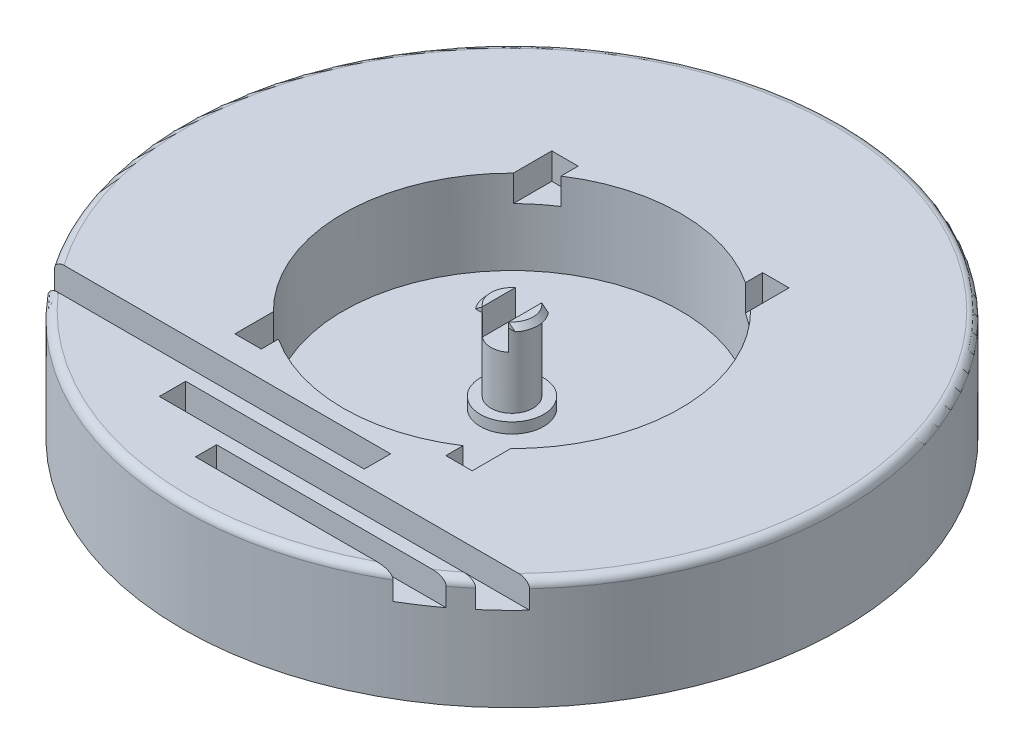
from build123d import *

# Parameters (mm, degrees)
SKETCH1_R           = 62.5
BOSS_EXTRUDE1_DEPTH = 21
SKETCH2_R           = 32
SKETCH2_R_2         = 6
CUT_EXTRUDE1_DEPTH  = 16
SKETCH3_R           = 6
SKETCH3_R_2         = 4
CUT_EXTRUDE2_DEPTH  = 14
CUT_EXTRUDE7_START  = -5
CUT_EXTRUDE7_DEPTH  = 5
FILLET1_R           = 1.5
BOSS_EXTRUDE2_START = 1
SKETCH12_R          = 4
BOSS_EXTRUDE2_DEPTH = 1
BOSS_EXTRUDE3_DEPTH = 1
SKETCH14_W          = 5
SKETCH14_H          = 8
CUT_EXTRUDE9_DEPTH  = 5


# Read off the part's stored shape, not the designer's step: Cut-Extrude7
with BuildPart() as part:
    # Sketch1 → Boss-Extrude1 (new body)
    with BuildSketch(Plane(origin=(0, 0, 0), x_dir=(1, 0, 0), z_dir=(0, 1, 0))):
        with Locations(Location((0, 0, 0), (0, 0, 90))):
            Circle(SKETCH1_R)
    extrude(amount=BOSS_EXTRUDE1_DEPTH)

    # Sketch2 → Cut-Extrude1 (cut)
    with BuildSketch(Plane(origin=(0, 21, 0), x_dir=(1, 0, 0), z_dir=(0, 1, 0))):
        with Locations(Location((0, 0, 0), (0, 0, 270))):
            Circle(SKETCH2_R)
        with Locations(Location((0, 0, 0), (0, 0, 270))):
            Circle(SKETCH2_R_2, mode=Mode.SUBTRACT)
    extrude(amount=-CUT_EXTRUDE1_DEPTH, mode=Mode.SUBTRACT)

    # Sketch3 → Cut-Extrude2 (cut)
    with BuildSketch(Plane(origin=(0, 21, 0), x_dir=(1, 0, 0), z_dir=(0, 1, 0))):
        with Locations(Location((0, 0, 0), (0, 0, 270))):
            Circle(SKETCH3_R)
        with Locations(Location((0, 0, 0), (0, 0, 270))):
            Circle(SKETCH3_R_2, mode=Mode.SUBTRACT)
    extrude(amount=-CUT_EXTRUDE2_DEPTH, mode=Mode.SUBTRACT)

    # Cut-Extrude7 outline → Cut-Extrude7 (cut)
    with BuildSketch(Plane(origin=(0, 21, 0), x_dir=(1, 0, 0), z_dir=(0, 1, 0)).offset(CUT_EXTRUDE7_START)):
        with BuildLine():
            Line((-48.023431781, -40), (11.976568219, -40))
            Line((11.976568219, -40), (11.976568219, -35))
            Line((11.976568219, -35), (-51.780787943, -35))
            ThreePointArc((-51.780787943, -35), (-49.964693221, -37.547029594), (-48.023431781, -40))
        make_face()
        with BuildLine():
            Line((-6.031762045, -54), (31.468237955, -54))
            ThreePointArc((31.468237955, -54), (34.542067999, -52.087383677), (37.5, -50))
            Line((37.5, -50), (-6.031762045, -50))
            Line((-6.031762045, -50), (-6.031762045, -54))
        make_face()
        with BuildLine():
            ThreePointArc((40.620192023, -47.5), (43.295213632, -45.075209113), (45.82575695, -42.5))
            Line((45.82575695, -42.5), (-19.379807977, -42.5))
            Line((-19.379807977, -42.5), (-19.379807977, -47.5))
            Line((-19.379807977, -47.5), (40.620192023, -47.5))
        make_face()
        with BuildLine():
            ThreePointArc((-17.5, -26.790856649), (-20.101587243, -24.898317018), (-22.5, -22.754120506))
            Line((-22.5, -22.754120506), (-22.5, -30.05))
            Line((-22.5, -30.05), (-17.5, -30.05))
            Line((-17.5, -30.05), (-17.5, -26.790856649))
        make_face()
        with BuildLine():
            Line((-22.5, 30.05), (-22.5, 22.754120506))
            ThreePointArc((-22.5, 22.754120506), (-20.101587243, 24.898317018), (-17.5, 26.790856649))
            Line((-17.5, 26.790856649), (-17.5, 30.05))
            Line((-17.5, 30.05), (-22.5, 30.05))
        make_face()
        with BuildLine():
            ThreePointArc((22.5, -22.754120506), (20.101587243, -24.898317018), (17.5, -26.790856649))
            Line((17.5, -26.790856649), (17.5, -30.05))
            Line((17.5, -30.05), (22.5, -30.05))
            Line((22.5, -30.05), (22.5, -22.754120506))
        make_face()
        with BuildLine():
            Line((17.5, 30.05), (17.5, 26.790856649))
            ThreePointArc((17.5, 26.790856649), (20.101587243, 24.898317018), (22.5, 22.754120506))
            Line((22.5, 22.754120506), (22.5, 30.05))
            Line((22.5, 30.05), (17.5, 30.05))
        make_face()
    extrude(amount=CUT_EXTRUDE7_DEPTH, mode=Mode.SUBTRACT)

    # Fillet1
    fillet1_edges = [part.edges().sort_by_distance(p)[0] for p in [
        (-10.840600106, 21, 61.552671667),
        (39.080092124, 21, 48.774956684),
        (57.282196187, 21, -25),
    ]]
    fillet(fillet1_edges, radius=FILLET1_R)

    # Sketch12 → Boss-Extrude2 (add)
    with BuildSketch(Plane(origin=(0, 21, 0), x_dir=(1, 0, 0), z_dir=(0, 1, 0)).offset(BOSS_EXTRUDE2_START)):
        with Locations(Location((0, 0, 0), (0, 0, 270))):
            Circle(SKETCH12_R)
    extrude(amount=-BOSS_EXTRUDE2_DEPTH)

    # Sketch13 → Boss-Extrude3 (add)
    with BuildSketch(Plane(origin=(0, 21, 0), x_dir=(1, 0, 0), z_dir=(0, 1, 0))):
        with BuildLine():
            Line((-3.75, -3.142053469), (3.75, -3.142053469))
            ThreePointArc((3.75, -3.142053469), (4.892340953, 0), (3.75, 3.142053469))
            Line((3.75, 3.142053469), (-3.75, 3.142053469))
            ThreePointArc((-3.75, 3.142053469), (-4.892340953, 0), (-3.75, -3.142053469))
        make_face()
    extrude(amount=BOSS_EXTRUDE3_DEPTH)

    # Sketch14 → Cut-Extrude9 (cut)
    with BuildSketch(Plane(origin=(0, 22, 0), x_dir=(1, 0, 0), z_dir=(0, 1, 0))):
        Rectangle(SKETCH14_W, SKETCH14_H)
    extrude(amount=-CUT_EXTRUDE9_DEPTH, mode=Mode.SUBTRACT)

    # Sketch16 → Cut-Revolve1 (revolve, cut)
    with BuildSketch(Plane.XY, mode=Mode.PRIVATE) as cut_revolve1_sk:
        Polygon((4.892340953, 21), (4, 22), (4.892340953, 22), align=None)
    revolve(cut_revolve1_sk.sketch.rotate(Axis((0, 0, 0), (0, 1, 0)), 214.055797743), axis=Axis((0, 0, 0), (0, 1, 0)), mode=Mode.SUBTRACT)


solid = part.part
